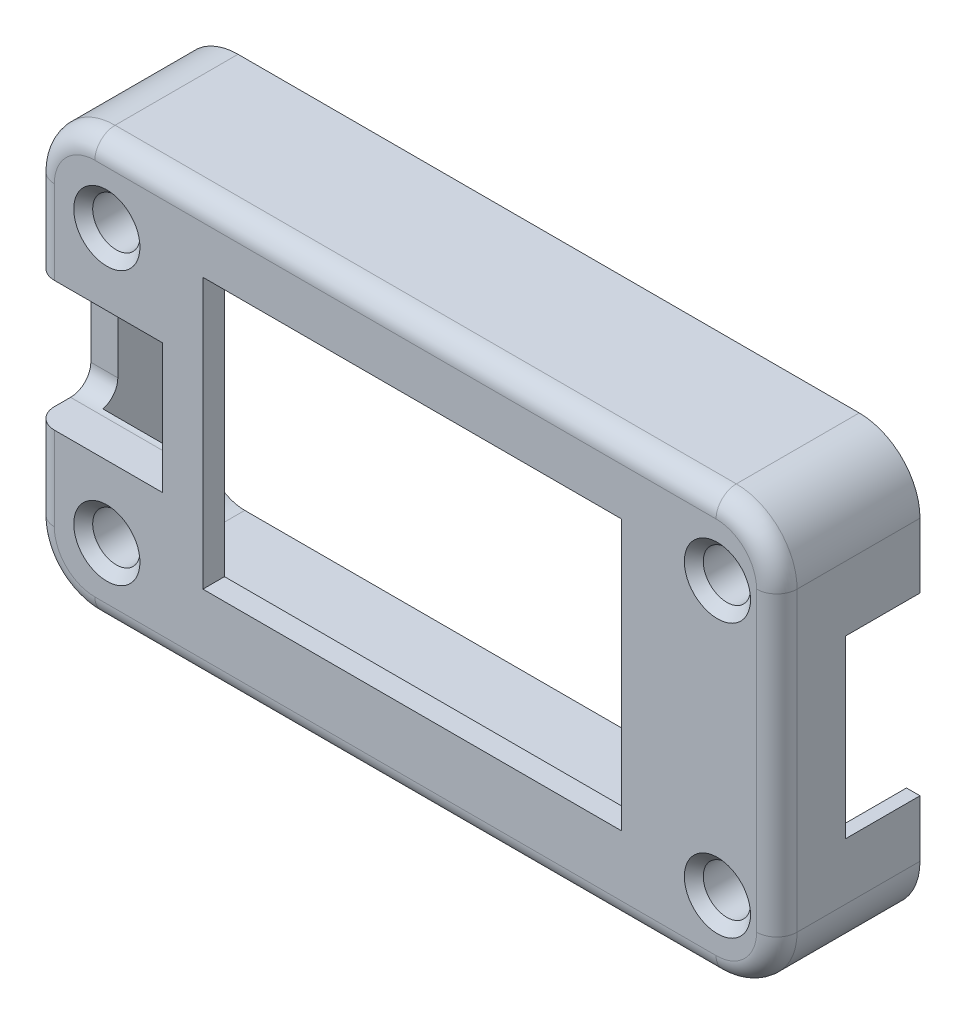
from build123d import *

# Parameters (mm, degrees)
SKETCH_1_W          = 55
SKETCH_1_H          = 31
SKETCH_1_W_2        = 52
SKETCH_1_H_2        = 27
EXTRUDE_1_DEPTH     = 9
SKETCH_2_W          = 55
SKETCH_2_H          = 31
EXTRUDE_2_DEPTH     = 1.6
CUT_EXTRUDE_1_REACH = 66.018
SKETCH_3_W          = 31
SKETCH_3_H          = 20
SKETCH_4_W          = 52
SKETCH_4_H          = 27
SKETCH_4_W_2        = 35
SKETCH_4_H_2        = 24
EXTRUDE_3_DEPTH     = 1.5
SKETCH_5_W          = 15
SKETCH_5_H          = 2
CUT_EXTRUDE_2_DEPTH = 1.5
SKETCH_7_W          = 9.5
SKETCH_7_H          = 9.6
CUT_EXTRUDE_4_DEPTH = 4.2
SKETCH_8_W          = 1
SKETCH_8_H          = 9.6
CUT_EXTRUDE_5_DEPTH = 1.5
SKETCH_9_W          = 1
SKETCH_9_H          = 13
CUT_EXTRUDE_6_DEPTH = 5.5
SKETCH_10_R         = 1.75
CUT_EXTRUDE_7_DEPTH = 64.578691399
FILLET_1_R          = 3
FILLET_2_R          = 4.5
FILLET_3_R          = 1.5
FILLET_4_R          = 1.5
CHAMFER_1_SIZE      = 0.7


with BuildPart() as part:
    # 草图1 → 凸台-拉伸1 (new body)
    with BuildSketch(Plane.XY):
        with Locations((27.5, -15.5)):
            Rectangle(SKETCH_1_W, SKETCH_1_H)
        with Locations((28, -15.5)):
            Rectangle(SKETCH_1_W_2, SKETCH_1_H_2, mode=Mode.SUBTRACT)
    extrude(amount=EXTRUDE_1_DEPTH)

    # 草图2 → 凸台-拉伸2 (add)
    with BuildSketch(Plane.XY.offset(9)):
        with Locations((27.5, -15.5)):
            Rectangle(SKETCH_2_W, SKETCH_2_H)
    extrude(amount=EXTRUDE_2_DEPTH)

    # 草图3 → 切除-拉伸1 (cut, up to next)
    with BuildSketch(Plane.XY.offset(10.6), mode=Mode.PRIVATE) as cut_extrude_1_sk1:
        with Locations((28, -15)):
            Rectangle(SKETCH_3_W, SKETCH_3_H)
    cut_extrude_1_tool1 = extrude(cut_extrude_1_sk1.sketch, amount=-CUT_EXTRUDE_1_REACH, mode=Mode.PRIVATE) & part.part
    add(cut_extrude_1_tool1.solids().sort_by_distance((28, -15, 10.6))[0], mode=Mode.SUBTRACT)

    # 草图4 → 凸台-拉伸3 (add)
    with BuildSketch(Plane(origin=(0, 0, 9), x_dir=(-1, 0, 0), z_dir=(0, 0, -1))):
        with Locations((-28, -15.5)):
            Rectangle(SKETCH_4_W, SKETCH_4_H)
        with Locations((-28, -15)):
            Rectangle(SKETCH_4_W_2, SKETCH_4_H_2, mode=Mode.SUBTRACT)
    extrude(amount=EXTRUDE_3_DEPTH)

    # 草图5 → 切除-拉伸2 (cut)
    with BuildSketch(Plane(origin=(0, 0, 7.5), x_dir=(-1, 0, 0), z_dir=(0, 0, -1))):
        with Locations((-28, -28)):
            Rectangle(SKETCH_5_W, SKETCH_5_H)
    extrude(amount=-CUT_EXTRUDE_2_DEPTH, mode=Mode.SUBTRACT)

    # 草图7 → 切除-拉伸4 (cut)
    with BuildSketch(Plane.XY.offset(10.6)):
        with Locations((4.75, -15.5)):
            Rectangle(SKETCH_7_W, SKETCH_7_H)
    extrude(amount=-CUT_EXTRUDE_4_DEPTH, mode=Mode.SUBTRACT)

    # 草图8 → 切除-拉伸5 (cut)
    with BuildSketch(Plane(origin=(0, 0, 7.5), x_dir=(-1, 0, 0), z_dir=(0, 0, -1))):
        with Locations((-10, -15.5)):
            Rectangle(SKETCH_8_W, SKETCH_8_H)
    extrude(amount=-CUT_EXTRUDE_5_DEPTH, mode=Mode.SUBTRACT)

    # 草图9 → 切除-拉伸6 (cut)
    with BuildSketch(Plane(origin=(0, 0, 0), x_dir=(-1, 0, 0), z_dir=(0, 0, -1))):
        with Locations((-54.5, -15.8)):
            Rectangle(SKETCH_9_W, SKETCH_9_H)
    extrude(amount=-CUT_EXTRUDE_6_DEPTH, mode=Mode.SUBTRACT)

    # 草图10 → 切除-拉伸7 (cut, through all)
    with BuildSketch(Plane(origin=(0, 0, 7.5), x_dir=(-1, 0, 0), z_dir=(0, 0, -1))):
        with Locations((-50.6, -5.4)):
            Circle(SKETCH_10_R)
        with Locations((-5.388, -5.4)):
            Circle(SKETCH_10_R)
        with Locations((-5.388, -25.6)):
            Circle(SKETCH_10_R)
        with Locations((-50.6, -25.6)):
            Circle(SKETCH_10_R)
    extrude(amount=-CUT_EXTRUDE_7_DEPTH, mode=Mode.SUBTRACT)

    # 圆角1
    fillet_1_edges = [part.edges().sort_by_distance(p)[0] for p in [
        (2, -29, 3.75),
        (54, -29, 3.75),
        (54, -2, 3.75),
        (2, -2, 3.75),
    ]]
    fillet(fillet_1_edges, radius=FILLET_1_R)

    # 圆角2
    fillet_2_edges = [part.edges().sort_by_distance(p)[0] for p in [
        (0, 0, 5.3),
        (0, -31, 5.3),
        (55, -31, 5.3),
        (55, 0, 5.3),
    ]]
    fillet(fillet_2_edges, radius=FILLET_2_R)

    # 圆角3
    fillet_3_edges = [part.edges().sort_by_distance(p)[0] for p in [
        (1, -20.3, 6.4),
        (1, -10.7, 6.4),
    ]]
    fillet(fillet_3_edges, radius=FILLET_3_R)

    # 圆角4
    fillet_4_edges = [part.edges().sort_by_distance(p)[0] for p in [
        (0, -23.4, 10.6),
        (1.318019485, -29.681980515, 10.6),
        (0, -7.6, 10.6),
        (1.318019485, -1.318019485, 10.6),
        (27.5, 0, 10.6),
        (53.681980515, -1.318019485, 10.6),
        (55, -15.5, 10.6),
        (53.681980515, -29.681980515, 10.6),
        (27.5, -31, 10.6),
    ]]
    fillet(fillet_4_edges, radius=FILLET_4_R)

    # 倒角1
    chamfer_1_edges = [part.edges().sort_by_distance(p)[0] for p in [
        (7.138, -5.4, 10.6),
        (7.138, -25.6, 10.6),
        (52.35, -5.4, 10.6),
        (52.35, -25.6, 10.6),
    ]]
    chamfer(chamfer_1_edges, length=CHAMFER_1_SIZE)


solid = part.part
